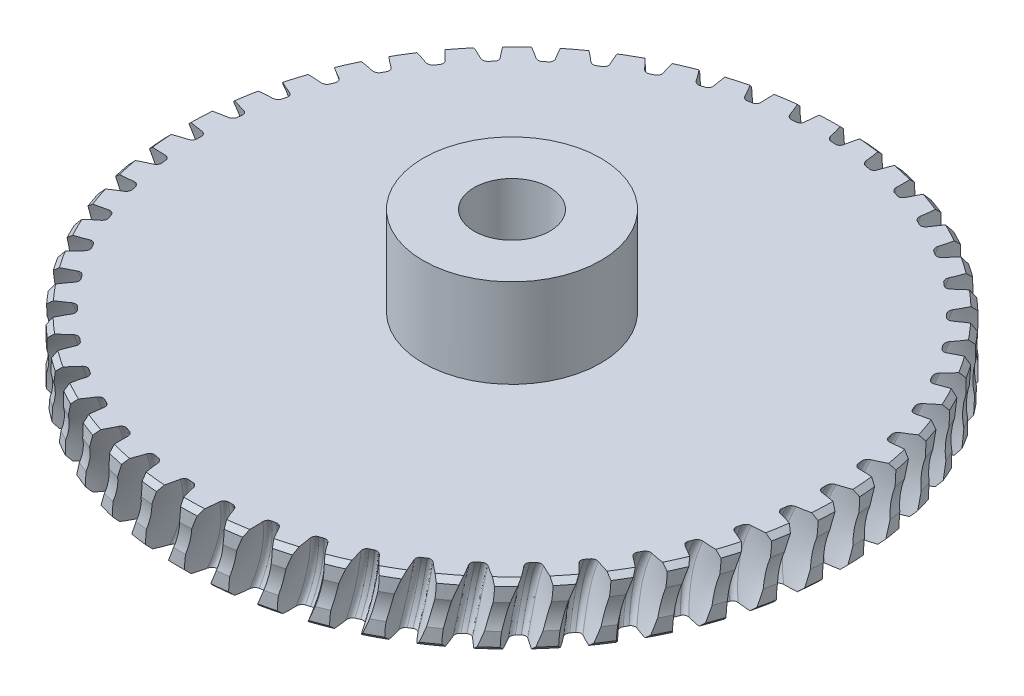
from build123d import *

# Parameters (mm, degrees)
CUT_SWEEP5_PITCH  = 9.974556675
CIRPATTERN1_COUNT = 50
HUBSKETCH1_R      = 11.175999939
HUB1_DEPTH        = 11.175999939
BORESKETCH_R      = 4.7625
BORE_DEPTH        = 12700


with BuildPart() as part:
    # wormGear → Revolve1 (revolve)
    with BuildSketch(Plane.XY, mode=Mode.PRIVATE) as revolve1_sk:
        with BuildLine():
            Line((0, -3.93700003), (0, 3.93700003))
            Line((0, 3.93700003), (-40.850027708, 3.93700003))
            Line((-40.850027708, 3.93700003), (-41.4734375, 3.313590238))
            Line((-41.4734375, 3.313590238), (-41.4734375, 1.575048827))
            ThreePointArc((-41.4734375, 1.575048827), (-41.275, 0), (-41.4734375, -1.575048827))
            Line((-41.4734375, -1.575048827), (-41.4734375, -3.313590238))
            Line((-41.4734375, -3.313590238), (-40.850027708, -3.93700003))
            Line((-40.850027708, -3.93700003), (0, -3.93700003))
        make_face()
    revolve(revolve1_sk.sketch.rotate(Axis((0, -3.93700003, 0), (0, 1, 0)), 180), axis=Axis((0, -3.93700003, 0), (0, 1, 0)))

    # Cut-Sweep5: arcs per turn and ends read off the stored shape
    # Cut-Sweep5: the profile of toothCut1 screwed along a right-hand helix through 0.5 turns, 8 arcs to a turn; built about Z, then put on its axis
    cut_sweep5_z = Axis((0, 0, 0), (0, 0, 1))
    cut_sweep5_corners = [(9.77518238, 0, -0.267447085), (9.77518238, 0, 0.267447085), (9.29065237, 0, 0.87959906), (5.274806136, 0, 2.397457762), (5.274806136, 0, -2.397457762), (9.29065237, 0, -0.87959906)]
    with BuildLine(mode=Mode.PRIVATE) as cut_sweep5_profile:
        ThreePointArc((9.77518238, 0, -0.267447085), (9.7742375, 0, 0), (9.77518238, 0, 0.267447085))
        ThreePointArc((9.77518238, 0, 0.267447085), (9.640605085, 0, 0.658759957), (9.29065237, 0, 0.87959906))
        ThreePointArc((9.29065237, 0, 0.87959906), (7.230761892, 0, 1.501036737), (5.274806136, 0, 2.397457762))
        ThreePointArc((5.274806136, 0, 2.397457762), (5.207, 0, 0), (5.274806136, 0, -2.397457762))
        ThreePointArc((5.274806136, 0, -2.397457762), (7.230761892, 0, -1.501036737), (9.29065237, 0, -0.87959906))
        ThreePointArc((9.29065237, 0, -0.87959906), (9.640605085, 0, -0.658759957), (9.77518238, 0, -0.267447085))
    cut_sweep5_cap = Face(cut_sweep5_profile.wire())
    cut_sweep5_arcs = [((9.77518238, 0, -0.267447085), (9.773292597, 0, 0), (9.77518238, 0, 0.267447085), (1, 0.9999750367056608, 1)), ((9.77518238, 0, 0.267447085), (9.778719859, 0, 0.768080445), (9.29065237, 0, 0.87959906), (1, 0.7796972598861693, 1)), ((9.29065237, 0, 0.87959906), (7.178304908, 0, 1.362249656), (5.274806136, 0, 2.397457762), (1, 0.9906662300716125, 1)), ((5.274806136, 0, 2.397457762), (5.1390853, 0, 0), (5.274806136, 0, -2.397457762), (1, 0.9984014772861283, 1)), ((5.274806136, 0, -2.397457762), (7.178304908, 0, -1.362249656), (9.29065237, 0, -0.87959906), (1, 0.9906662300716131, 1)), ((9.29065237, 0, -0.87959906), (9.778719859, 0, -0.768080445), (9.77518238, 0, -0.267447085), (1, 0.7796972598861694, 1))]  # start, shoulder, end, weights
    cut_sweep5_turn_angles = [0, 22.5, 45, 67.5, 90, 112.5, 135, 157.5, 180]
    cut_sweep5_turn_weights = [1, 0.9238795325112867, 1, 0.9238795325112867, 1, 0.9238795325112867, 1, 0.9238795325112856, 1]
    cut_sweep5_turn_sides = [Face.make_bezier_surface([[Vector(p[j][0], p[j][1], 0).rotate(cut_sweep5_z, cut_sweep5_turn_angles[2 * i + k]) / cut_sweep5_turn_weights[2 * i + k] + Vector(0, 0, p[j][2] + CUT_SWEEP5_PITCH * cut_sweep5_turn_angles[2 * i + k] / 360) for k in range(3)] for j in range(3)], [[p[3][j] * cut_sweep5_turn_weights[2 * i + k] for k in range(3)] for j in range(3)]) for p in cut_sweep5_arcs for i in range(4)]
    cut_sweep5 = Plane(origin=(-47.625, 0, -2.493639169), x_dir=(0, -1, 0), z_dir=(0, 0, 1)) * Solid(Shell([*cut_sweep5_turn_sides, cut_sweep5_cap, cut_sweep5_cap.rotate(cut_sweep5_z, 180).moved(Location((0, 0, CUT_SWEEP5_PITCH * 180 / 360)))]))
    add(cut_sweep5, mode=Mode.SUBTRACT)

    # CirPattern1: Cut-Sweep5 ×50 about axis
    cirpattern1_axis = Axis((0, 0, 0), (0, 1, 0))
    for i in range(1, CIRPATTERN1_COUNT):
        add(cut_sweep5.rotate(cirpattern1_axis, i * 360 / CIRPATTERN1_COUNT), mode=Mode.SUBTRACT)

    # hubSketch1 → hub1 (add)
    with BuildSketch(Plane(origin=(0, 3.93700003, 0), x_dir=(-1, 0, 0), z_dir=(0, 1, 0))):
        with Locations(Location((0, 0, 0), (0, 0, 180))):
            Circle(HUBSKETCH1_R)
    extrude(amount=HUB1_DEPTH)

    # boreSketch → bore (cut, symmetric)
    with BuildSketch(Plane(origin=(0, 0, 0), x_dir=(1, 0, 0), z_dir=(0, 1, 0))):
        with Locations(Location((0, 0, 0), (0, 0, 270))):
            Circle(BORESKETCH_R)
    extrude(amount=BORE_DEPTH, both=True, mode=Mode.SUBTRACT)


solid = part.part
